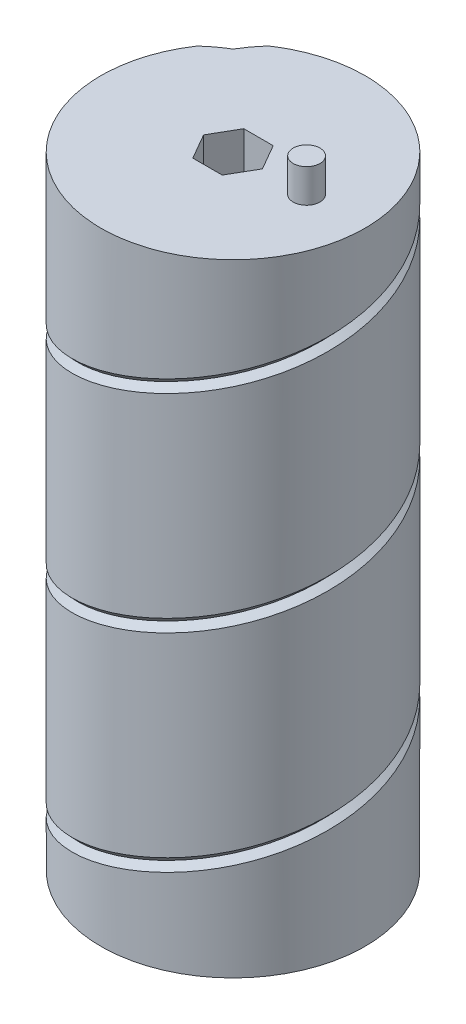
from build123d import *

# Parameters (mm, degrees)
SKETCH1_2_R                  = 19.75
EXTRUDE_MAIN_BODY_DEPTH      = 93
CUT_ANTENNA_WIRE_GUIDE_PITCH = 31
SKETCH28_R                   = 2
EXTRUDED_PEG_DEPTH           = 5
HOLE_FOR_THREADED_ROD_D      = 4.4958
SKETCH31_R                   = 2.25
CUT_PEG_DEPTH                = 5.5
CUT_EXTRUDE1_DEPTH           = 26.67


with BuildPart() as part:
    # Sketch1<2> → Extrude - Main Body (new body)
    with BuildSketch(Plane(origin=(0, 0, 0), x_dir=(1, 0, 0), z_dir=(0, 1, 0))):
        with Locations(Location((0, 0, 0), (0, 0, 90))):
            Circle(SKETCH1_2_R)
    extrude(amount=EXTRUDE_MAIN_BODY_DEPTH)

    # Cut - Antenna Wire Guide: arcs per turn and ends read off the stored shape
    # Cut - Antenna Wire Guide: the profile of Sketch15 screwed along a right-hand helix through 4.5 turns, 24 arcs to a turn; built about Z, then put on its axis
    cut_antenna_wire_guide_z = Axis((0, 0, 0), (0, 0, 1))
    cut_antenna_wire_guide_corners = [(19.75, 0, -31), (19.75, 0.222791045, -31.891831907), (18.830761184, 0, -31), (19.75, -0.222791045, -30.108168093)]
    with BuildLine(mode=Mode.PRIVATE) as cut_antenna_wire_guide_profile:
        Line(cut_antenna_wire_guide_corners[0], cut_antenna_wire_guide_corners[1])
        Line(cut_antenna_wire_guide_corners[1], cut_antenna_wire_guide_corners[2])
        Line(cut_antenna_wire_guide_corners[2], cut_antenna_wire_guide_corners[3])
        Line(cut_antenna_wire_guide_corners[3], cut_antenna_wire_guide_corners[0])
    cut_antenna_wire_guide_cap = Face(cut_antenna_wire_guide_profile.wire())
    cut_antenna_wire_guide_turn_angles = [0, 7.5, 15, 22.5, 30, 37.5, 45, 52.5, 60, 67.5, 75, 82.5, 90, 97.5, 105, 112.5, 120, 127.5, 135, 142.5, 150, 157.5, 165, 172.5, 180, 187.5, 195, 202.5, 210, 217.5, 225, 232.5, 240, 247.5, 255, 262.5, 270, 277.5, 285, 292.5, 300, 307.5, 315, 322.5, 330, 337.5, 345, 352.5, 360]
    cut_antenna_wire_guide_turn_weights = [1, 0.9914448613738104, 1, 0.9914448613738104, 1, 0.9914448613738104, 1, 0.9914448613738104, 1, 0.9914448613738104, 1, 0.9914448613738104, 1, 0.9914448613738104, 1, 0.9914448613738104, 1, 0.9914448613738104, 1, 0.9914448613738104, 1, 0.9914448613738104, 1, 0.9914448613738104, 1, 0.9914448613738104, 1, 0.9914448613738104, 1, 0.9914448613738104, 1, 0.9914448613738104, 1, 0.9914448613738104, 1, 0.9914448613738104, 1, 0.9914448613738104, 1, 0.9914448613738104, 1, 0.9914448613738104, 1, 0.9914448613738104, 1, 0.9914448613738104, 1, 0.9914448613738104, 1]
    cut_antenna_wire_guide_turn_rails = [Edge.make_bspline([Vector(p[0], p[1], 0).rotate(cut_antenna_wire_guide_z, cut_antenna_wire_guide_turn_angles[k]) / cut_antenna_wire_guide_turn_weights[k] + Vector(0, 0, p[2] + CUT_ANTENNA_WIRE_GUIDE_PITCH * cut_antenna_wire_guide_turn_angles[k] / 360) for k in range(49)], [0, 0, 0, 1, 1, 2, 2, 3, 3, 4, 4, 5, 5, 6, 6, 7, 7, 8, 8, 9, 9, 10, 10, 11, 11, 12, 12, 13, 13, 14, 14, 15, 15, 16, 16, 17, 17, 18, 18, 19, 19, 20, 20, 21, 21, 22, 22, 23, 23, 24, 24, 24], 2, cut_antenna_wire_guide_turn_weights) for p in cut_antenna_wire_guide_corners]
    cut_antenna_wire_guide_turn_sides = [Face.make_surface_from_curves(cut_antenna_wire_guide_turn_rails[p[0]], cut_antenna_wire_guide_turn_rails[p[1]]) for p in [(0, 1), (1, 2), (2, 3), (3, 0)]]
    cut_antenna_wire_guide_last_angles = [1440, 1447.5, 1455, 1462.5, 1470, 1477.5, 1485, 1492.5, 1500, 1507.5, 1515, 1522.5, 1530, 1537.5, 1545, 1552.5, 1560, 1567.5, 1575, 1582.5, 1590, 1597.5, 1605, 1612.5, 1620]
    cut_antenna_wire_guide_last_weights = [1, 0.9914448613738104, 1, 0.9914448613738104, 1, 0.9914448613738104, 1, 0.9914448613738104, 1, 0.9914448613738104, 1, 0.9914448613738104, 1, 0.9914448613738104, 1, 0.9914448613738104, 1, 0.9914448613738104, 1, 0.9914448613738104, 1, 0.9914448613738104, 1, 0.9914448613738104, 1]
    cut_antenna_wire_guide_last_rails = [Edge.make_bspline([Vector(p[0], p[1], 0).rotate(cut_antenna_wire_guide_z, cut_antenna_wire_guide_last_angles[k]) / cut_antenna_wire_guide_last_weights[k] + Vector(0, 0, p[2] + CUT_ANTENNA_WIRE_GUIDE_PITCH * cut_antenna_wire_guide_last_angles[k] / 360) for k in range(25)], [0, 0, 0, 1, 1, 2, 2, 3, 3, 4, 4, 5, 5, 6, 6, 7, 7, 8, 8, 9, 9, 10, 10, 11, 11, 12, 12, 12], 2, cut_antenna_wire_guide_last_weights) for p in cut_antenna_wire_guide_corners]
    cut_antenna_wire_guide_last_sides = [Face.make_surface_from_curves(cut_antenna_wire_guide_last_rails[p[0]], cut_antenna_wire_guide_last_rails[p[1]]) for p in [(0, 1), (1, 2), (2, 3), (3, 0)]]
    cut_antenna_wire_guide = Plane(origin=(0, 0, 0), x_dir=(-0.7071067811865537, 0, -0.7071067811865414), z_dir=(0, 1, 0)) * Solid(Shell([*[p.moved(Location((0, 0, CUT_ANTENNA_WIRE_GUIDE_PITCH * i))) for i in range(4) for p in cut_antenna_wire_guide_turn_sides], *cut_antenna_wire_guide_last_sides, cut_antenna_wire_guide_cap, cut_antenna_wire_guide_cap.rotate(cut_antenna_wire_guide_z, 1620).moved(Location((0, 0, CUT_ANTENNA_WIRE_GUIDE_PITCH * 1620 / 360)))]))
    add(cut_antenna_wire_guide, mode=Mode.SUBTRACT)

    # Sketch28 → Extruded Peg (add)
    with BuildSketch(Plane(origin=(0, 93, 0), x_dir=(1, 0, 0), z_dir=(0, 1, 0))):
        with Locations(Location((11, 0, 0), (0, 0, 270))):
            Circle(SKETCH28_R)
    extrude(amount=EXTRUDED_PEG_DEPTH)

    # Hole for Threaded Rod (through all)
    with Locations(Plane(origin=(0, 93, 0), x_dir=(1, 0, 0), z_dir=(0, 1, 0))):
        with Locations((0, 0)):
            Hole(HOLE_FOR_THREADED_ROD_D / 2)

    # Sketch31 → Cut Peg (cut)
    with BuildSketch(Plane.XZ):
        with Locations(Location((11, 0, 0), (0, 0, 270))):
            Circle(SKETCH31_R)
    extrude(amount=-CUT_PEG_DEPTH, mode=Mode.SUBTRACT)

    # Sketch32 → Cut-Extrude1 (cut)
    with BuildSketch(Plane(origin=(0, 93, 0), x_dir=(1, 0, 0), z_dir=(0, 1, 0))):
        Polygon((-2.199704526, -3.81), (2.199704526, -3.81), (4.399409051, 0), (2.199704526, 3.81), (-2.199704526, 3.81), (-4.399409051, 0), align=None)
    extrude(amount=-CUT_EXTRUDE1_DEPTH, mode=Mode.SUBTRACT)


solid = part.part
